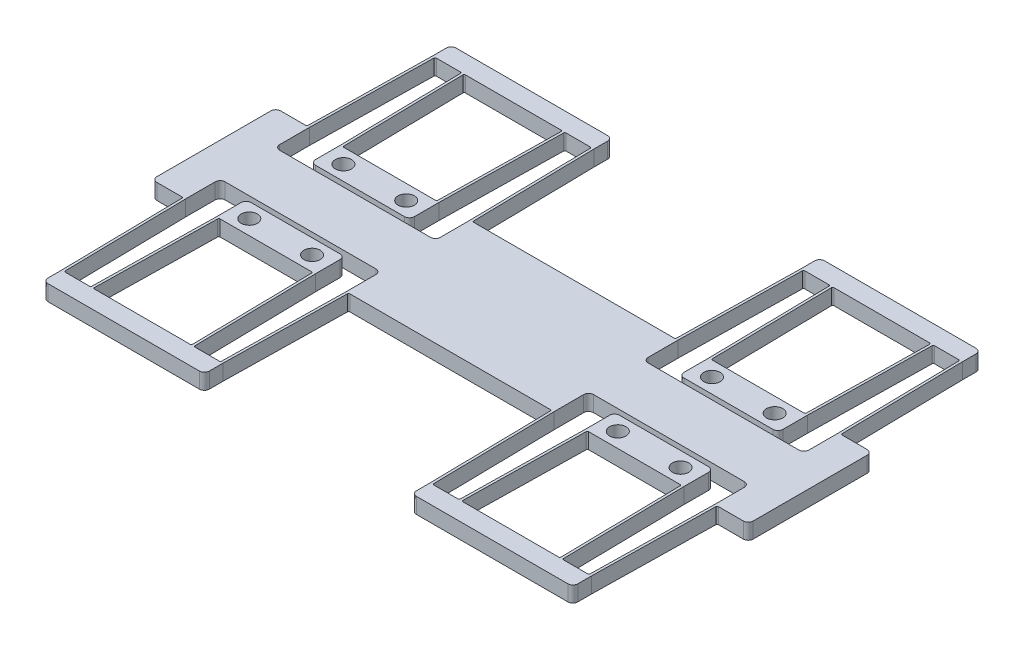
from build123d import *

# Parameters (mm, degrees)
ADJUST_THIS_FLEXTURE_CORNER_W              = 40
ADJUST_THIS_FLEXTURE_CORNER_H              = 12
CORNER_EXTRUDE_DEPTH                       = 3.175
FLEXTURE_BEAM_FILLETS_R                    = 0.5
OUTER_FILLETS_R                            = 2
M6_CLEARANCE_HOLE1_D                       = 6.6
FLEXTURE_BEAM_FILLETS_OF_LEFT_RIGHT_MIRR_R = 0.5
OUTER_FILLETS_OF_LEFT_RIGHT_MIRROR_R       = 2
TOP_BOTTOM_MIRROR_START                    = -3.175
TOP_BOTTOM_MIRROR_OUTLINE_R                = 3.3
TOP_BOTTOM_MIRROR_DEPTH                    = 6.35


# Read off the part's stored shape, not the designer's step: Top-Bottom-Mirror
with BuildPart() as part:
    # ADJUST THIS Flexture-Corner → Corner-Extrude (new, symmetric)
    with BuildSketch(Plane(origin=(0, 0, 0), x_dir=(1, 0, 0), z_dir=(0, 1, 0))):
        Polygon((-120.65, 0), (0, 0), (0, 25.05), (-42.049, 25.05), (-42.049, 11.05), (-107.049, 11.05), (-107.049, 25.05), (-120.65, 25.05), align=None)
        Polygon((-41.921600918, 75.05), (-41.921600918, 82.55), (-107.176399082, 82.55), (-107.176399082, 75.05), (-106.176246754, 75.05), (-95.421753246, 75.05), (-94.421600918, 75.05), (-54.676399082, 75.05), (-53.676246754, 75.05), (-42.921753246, 75.05), align=None)
        with Locations((-74.549, 19.05)):
            Rectangle(ADJUST_THIS_FLEXTURE_CORNER_W, ADJUST_THIS_FLEXTURE_CORNER_H)
        Polygon((-107.176399082, 75.05), (-108.049152328, 25.05), (-107.049, 25.05), (-106.176246754, 75.05), align=None)
        Polygon((-94.549, 25.05), (-95.421753246, 75.05), (-94.421600918, 75.05), (-93.548847672, 25.05), align=None)
        Polygon((-54.549, 25.05), (-53.676246754, 75.05), (-54.676399082, 75.05), (-55.549152328, 25.05), align=None)
        Polygon((-41.921600918, 75.05), (-41.048847672, 25.05), (-42.049, 25.05), (-42.921753246, 75.05), align=None)
    corner_extrude = extrude(amount=CORNER_EXTRUDE_DEPTH, both=True)

    # Flexture-Beam-Fillets
    flexture_beam_fillets_edges = [part.edges().sort_by_distance(p)[0] for p in [
        (-107.049, 0, -25.05),
        (-42.049, 0, -25.05),
        (-108.049152328, 0, -25.05),
        (-41.048847672, 0, -25.05),
        (-54.676399082, 0, -75.05),
        (-53.676246754, 0, -75.05),
        (-95.421753246, 0, -75.05),
        (-94.421600918, 0, -75.05),
        (-106.176246754, 0, -75.05),
        (-42.921753246, 0, -75.05),
        (-41.921600918, 0, -75.05),
        (-107.176399082, 0, -75.05),
        (-93.548847672, 0, -25.05),
        (-55.549152328, 0, -25.05),
        (-94.549, 0, -25.05),
        (-54.549, 0, -25.05),
    ]]
    fillet(flexture_beam_fillets_edges, radius=FLEXTURE_BEAM_FILLETS_R)

    # Outer-Fillets
    outer_fillets_edges = [part.edges().sort_by_distance(p)[0] for p in [
        (-120.65, 0, -25.05),
        (-107.049, 0, -11.05),
        (-42.049, 0, -11.05),
        (-41.921600918, 0, -82.55),
        (-107.176399082, 0, -82.55),
        (-94.549, 0, -13.05),
        (-54.549, 0, -13.05),
    ]]
    fillet(outer_fillets_edges, radius=OUTER_FILLETS_R)

    # M6 Clearance Hole1 (through all)
    with Locations(Plane(origin=(0, 3.175, 0), x_dir=(1, 0, 0), z_dir=(0, 1, 0))):
        with Locations((-87.249, -19.05), (-61.849, -19.05), (-61.849, 19.05), (-87.249, 19.05), (61.849, 19.05), (87.249, 19.05), (61.849, -19.05), (87.249, -19.05)):
            m6_clearance_hole1 = Hole(M6_CLEARANCE_HOLE1_D / 2)

    # Left-Right-Mirror: Corner-Extrude, M6 Clearance Hole1 across plane
    add(corner_extrude.mirror(Plane(origin=(0, 0, 0), x_dir=(0, 0, 1), z_dir=(1, 0, 0))))
    add(m6_clearance_hole1.mirror(Plane(origin=(0, 0, 0), x_dir=(0, 0, 1), z_dir=(1, 0, 0))), mode=Mode.SUBTRACT)

    # Flexture-Beam-Fillets of Left-Right-Mirr
    flexture_beam_fillets_of_left_right_mirr_edges = [part.edges().sort_by_distance(p)[0] for p in [
        (107.049, 0, -25.05),
        (42.049, 0, -25.05),
        (108.049152328, 0, -25.05),
        (41.048847672, 0, -25.05),
        (54.676399082, 0, -75.05),
        (53.676246754, 0, -75.05),
        (95.421753246, 0, -75.05),
        (94.421600918, 0, -75.05),
        (106.176246754, 0, -75.05),
        (42.921753246, 0, -75.05),
        (41.921600918, 0, -75.05),
        (107.176399082, 0, -75.05),
        (93.548847672, 0, -25.05),
        (55.549152328, 0, -25.05),
        (94.549, 0, -25.05),
        (54.549, 0, -25.05),
    ]]
    fillet(flexture_beam_fillets_of_left_right_mirr_edges, radius=FLEXTURE_BEAM_FILLETS_OF_LEFT_RIGHT_MIRR_R)

    # Outer-Fillets of Left-Right-Mirror
    outer_fillets_of_left_right_mirror_edges = [part.edges().sort_by_distance(p)[0] for p in [
        (120.65, 0, -25.05),
        (107.049, 0, -11.05),
        (42.049, 0, -11.05),
        (41.921600918, 0, -82.55),
        (107.176399082, 0, -82.55),
        (94.549, 0, -13.05),
        (54.549, 0, -13.05),
    ]]
    fillet(outer_fillets_of_left_right_mirror_edges, radius=OUTER_FILLETS_OF_LEFT_RIGHT_MIRROR_R)

    # Top-Bottom-Mirror outline → Top-Bottom-Mirror (add)
    with BuildSketch(Plane(origin=(0, 0, 0), x_dir=(1, 0, 0), z_dir=(0, 1, 0)).offset(TOP_BOTTOM_MIRROR_START)):
        with BuildLine():
            Line((-120.65, 0), (-120.65, -23.05))
            ThreePointArc((-120.65, -23.05), (-120.064213562, -24.464213562), (-118.65, -25.05))
            Line((-118.65, -25.05), (-108.54050096, -25.05))
            ThreePointArc((-108.54050096, -25.05), (-108.190046327, -25.193374775), (-108.040577112, -25.541273797))
            Line((-108.040577112, -25.541273797), (-107.176475234, -75.045637231))
            ThreePointArc((-107.176475234, -75.045637231), (-107.17641812, -75.050000166), (-107.176399082, -75.054363434))
            Line((-107.176399082, -75.054363434), (-107.176399082, -80.55))
            ThreePointArc((-107.176399082, -80.55), (-106.590612644, -81.964213562), (-105.176399082, -82.55))
            Line((-105.176399082, -82.55), (-43.921600918, -82.55))
            ThreePointArc((-43.921600918, -82.55), (-42.507387356, -81.964213562), (-41.921600918, -80.55))
            Line((-41.921600918, -80.55), (-41.921600918, -75.054363434))
            ThreePointArc((-41.921600918, -75.054363434), (-41.92158188, -75.050000166), (-41.921524766, -75.045637231))
            Line((-41.921524766, -75.045637231), (-41.057422888, -25.541273797))
            ThreePointArc((-41.057422888, -25.541273797), (-40.907953673, -25.193374775), (-40.55749904, -25.05))
            Line((-40.55749904, -25.05), (40.55749904, -25.05))
            ThreePointArc((40.55749904, -25.05), (40.907953673, -25.193374775), (41.057422888, -25.541273797))
            Line((41.057422888, -25.541273797), (41.921524766, -75.045637231))
            ThreePointArc((41.921524766, -75.045637231), (41.92158188, -75.050000166), (41.921600918, -75.054363434))
            Line((41.921600918, -75.054363434), (41.921600918, -80.55))
            ThreePointArc((41.921600918, -80.55), (42.507387356, -81.964213562), (43.921600918, -82.55))
            Line((43.921600918, -82.55), (105.176399082, -82.55))
            ThreePointArc((105.176399082, -82.55), (106.590612644, -81.964213562), (107.176399082, -80.55))
            Line((107.176399082, -80.55), (107.176399082, -75.054363434))
            ThreePointArc((107.176399082, -75.054363434), (107.17641812, -75.050000166), (107.176475234, -75.045637231))
            Line((107.176475234, -75.045637231), (108.040577112, -25.541273797))
            ThreePointArc((108.040577112, -25.541273797), (108.190046327, -25.193374775), (108.54050096, -25.05))
            Line((108.54050096, -25.05), (118.65, -25.05))
            ThreePointArc((118.65, -25.05), (120.064213562, -24.464213562), (120.65, -23.05))
            Line((120.65, -23.05), (120.65, 0))
            Line((120.65, 0), (-120.65, 0))
        make_face()
        with BuildLine():
            ThreePointArc((-93.557422888, -25.541273797), (-93.407953673, -25.193374775), (-93.05749904, -25.05))
            Line((-93.05749904, -25.05), (-56.04050096, -25.05))
            ThreePointArc((-56.04050096, -25.05), (-55.690046327, -25.193374775), (-55.540577112, -25.541273797))
            Line((-55.540577112, -25.541273797), (-54.685278931, -74.541273797))
            ThreePointArc((-54.685278931, -74.541273797), (-54.828577554, -74.900454632), (-55.185202778, -75.05))
            Line((-55.185202778, -75.05), (-93.912797222, -75.05))
            ThreePointArc((-93.912797222, -75.05), (-94.269422446, -74.900454632), (-94.412721069, -74.541273797))
            Line((-94.412721069, -74.541273797), (-93.557422888, -25.541273797))
        make_face(mode=Mode.SUBTRACT)
        with BuildLine():
            ThreePointArc((-44.049, -11.05), (-42.634786438, -11.635786438), (-42.049, -13.05))
            Line((-42.049, -13.05), (-42.049, -25.045636566))
            ThreePointArc((-42.049, -25.045636566), (-42.049019038, -25.049999834), (-42.049076152, -25.054362769))
            Line((-42.049076152, -25.054362769), (-42.91317803, -74.558726203))
            ThreePointArc((-42.91317803, -74.558726203), (-43.062647246, -74.906625225), (-43.413101878, -75.05))
            Line((-43.413101878, -75.05), (-53.184898122, -75.05))
            ThreePointArc((-53.184898122, -75.05), (-53.535352754, -74.906625225), (-53.68482197, -74.558726203))
            Line((-53.68482197, -74.558726203), (-54.548923848, -25.054362769))
            ThreePointArc((-54.548923848, -25.054362769), (-54.548980962, -25.049999834), (-54.549, -25.045636566))
            Line((-54.549, -25.045636566), (-54.549, -15.05))
            ThreePointArc((-54.549, -15.05), (-55.134786438, -13.635786438), (-56.549, -13.05))
            Line((-56.549, -13.05), (-92.549, -13.05))
            ThreePointArc((-92.549, -13.05), (-93.963213562, -13.635786438), (-94.549, -15.05))
            Line((-94.549, -15.05), (-94.549, -25.045636566))
            ThreePointArc((-94.549, -25.045636566), (-94.549019038, -25.049999834), (-94.549076152, -25.054362769))
            Line((-94.549076152, -25.054362769), (-95.41317803, -74.558726203))
            ThreePointArc((-95.41317803, -74.558726203), (-95.562647246, -74.906625225), (-95.913101878, -75.05))
            Line((-95.913101878, -75.05), (-105.684898122, -75.05))
            ThreePointArc((-105.684898122, -75.05), (-106.035352754, -74.906625225), (-106.18482197, -74.558726203))
            Line((-106.18482197, -74.558726203), (-107.048923848, -25.054362769))
            ThreePointArc((-107.048923848, -25.054362769), (-107.048980962, -25.049999834), (-107.049, -25.045636566))
            Line((-107.049, -25.045636566), (-107.049, -13.05))
            ThreePointArc((-107.049, -13.05), (-106.463213562, -11.635786438), (-105.049, -11.05))
            Line((-105.049, -11.05), (-44.049, -11.05))
        make_face(mode=Mode.SUBTRACT)
        with BuildLine():
            Line((56.04050096, -25.05), (93.05749904, -25.05))
            ThreePointArc((93.05749904, -25.05), (93.407953673, -25.193374775), (93.557422888, -25.541273797))
            Line((93.557422888, -25.541273797), (94.412721069, -74.541273797))
            ThreePointArc((94.412721069, -74.541273797), (94.269422446, -74.900454632), (93.912797222, -75.05))
            Line((93.912797222, -75.05), (55.185202778, -75.05))
            ThreePointArc((55.185202778, -75.05), (54.828577554, -74.900454632), (54.685278931, -74.541273797))
            Line((54.685278931, -74.541273797), (55.540577112, -25.541273797))
            ThreePointArc((55.540577112, -25.541273797), (55.690046327, -25.193374775), (56.04050096, -25.05))
        make_face(mode=Mode.SUBTRACT)
        with BuildLine():
            Line((107.049, -13.05), (107.049, -25.045636566))
            ThreePointArc((107.049, -25.045636566), (107.048980962, -25.049999834), (107.048923848, -25.054362769))
            Line((107.048923848, -25.054362769), (106.18482197, -74.558726203))
            ThreePointArc((106.18482197, -74.558726203), (106.035352754, -74.906625225), (105.684898122, -75.05))
            Line((105.684898122, -75.05), (95.913101878, -75.05))
            ThreePointArc((95.913101878, -75.05), (95.562647246, -74.906625225), (95.41317803, -74.558726203))
            Line((95.41317803, -74.558726203), (94.549076152, -25.054362769))
            ThreePointArc((94.549076152, -25.054362769), (94.549019038, -25.049999834), (94.549, -25.045636566))
            Line((94.549, -25.045636566), (94.549, -15.05))
            ThreePointArc((94.549, -15.05), (93.963213562, -13.635786438), (92.549, -13.05))
            Line((92.549, -13.05), (56.549, -13.05))
            ThreePointArc((56.549, -13.05), (55.134786438, -13.635786438), (54.549, -15.05))
            Line((54.549, -15.05), (54.549, -25.045636566))
            ThreePointArc((54.549, -25.045636566), (54.548980962, -25.049999834), (54.548923848, -25.054362769))
            Line((54.548923848, -25.054362769), (53.68482197, -74.558726203))
            ThreePointArc((53.68482197, -74.558726203), (53.535352754, -74.906625225), (53.184898122, -75.05))
            Line((53.184898122, -75.05), (43.413101878, -75.05))
            ThreePointArc((43.413101878, -75.05), (43.062647246, -74.906625225), (42.91317803, -74.558726203))
            Line((42.91317803, -74.558726203), (42.049076152, -25.054362769))
            ThreePointArc((42.049076152, -25.054362769), (42.049019038, -25.049999834), (42.049, -25.045636566))
            Line((42.049, -25.045636566), (42.049, -13.05))
            ThreePointArc((42.049, -13.05), (42.634786438, -11.635786438), (44.049, -11.05))
            Line((44.049, -11.05), (105.049, -11.05))
            ThreePointArc((105.049, -11.05), (106.463213562, -11.635786438), (107.049, -13.05))
        make_face(mode=Mode.SUBTRACT)
        with Locations((-87.249, -19.05)):
            Circle(TOP_BOTTOM_MIRROR_OUTLINE_R, mode=Mode.SUBTRACT)
        with Locations((-61.849, -19.05)):
            Circle(TOP_BOTTOM_MIRROR_OUTLINE_R, mode=Mode.SUBTRACT)
        with Locations((61.849, -19.05)):
            Circle(TOP_BOTTOM_MIRROR_OUTLINE_R, mode=Mode.SUBTRACT)
        with Locations((87.249, -19.05)):
            Circle(TOP_BOTTOM_MIRROR_OUTLINE_R, mode=Mode.SUBTRACT)
    extrude(amount=TOP_BOTTOM_MIRROR_DEPTH)


solid = part.part
